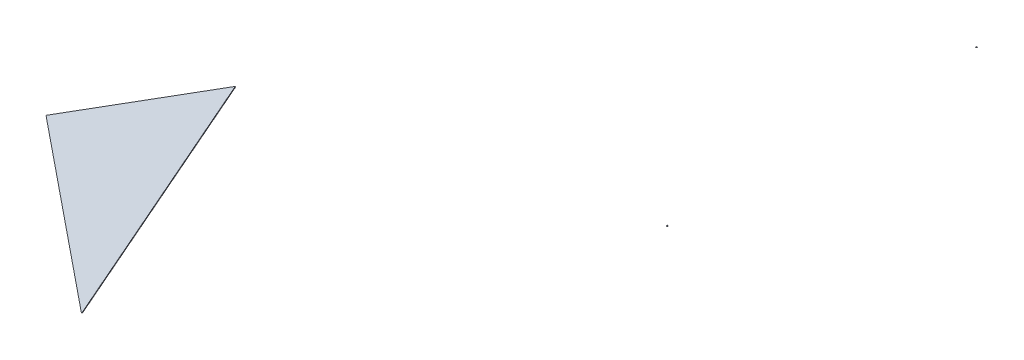
from build123d import *

# Parameters (mm, degrees)
SKETCH2_W          = 846.839584843
SKETCH2_H          = 871.457014635
CUT_EXTRUDE2_DEPTH = 1248.41
SKETCH3_W          = 597.069036036
SKETCH3_H          = 378.549018711
CUT_EXTRUDE3_DEPTH = 327.533


with BuildPart() as part:
    # Boss-Extrude1: read off the stored shape, not the designer's step
    # Boss-Extrude1: loft between two sections, ruled curve by curve
    boss_extrude1_from = [
        Edge.make_line((-86.167457674, 1821.517106037, 1121.25455637), (-492.567457674, 1821.517106037, 1451.45455637)),
        Edge.make_line((-492.567457674, 1821.517106037, 1451.45455637), (752.550801769, 2608.917106037, 1451.45455637)),
        Edge.make_line((752.550801769, 2608.917106037, 1451.45455637), (1158.950801769, 2608.917106037, 1121.25455637)),
        Edge.make_line((1158.950801769, 2608.917106037, 1121.25455637), (-86.167457674, 1821.517106037, 1121.25455637)),
    ]
    boss_extrude1_to = [
        Edge.make_line((-89.342457674, 1821.517106037, 1121.25455637), (-495.742457674, 1821.517106037, 1451.45455637)),
        Edge.make_line((-495.742457674, 1821.517106037, 1451.45455637), (749.375801769, 2608.917106037, 1451.45455637)),
        Edge.make_line((749.375801769, 2608.917106037, 1451.45455637), (1155.775801769, 2608.917106037, 1121.25455637)),
        Edge.make_line((1155.775801769, 2608.917106037, 1121.25455637), (-89.342457674, 1821.517106037, 1121.25455637)),
    ]
    boss_extrude1 = Solid(Shell([*[Face.make_surface_from_curves(boss_extrude1_from[k], boss_extrude1_to[k]) for k in range(4)], Face(Wire(boss_extrude1_from)), Face(Wire(boss_extrude1_to))]))
    add(boss_extrude1)

    # Mirror1: Boss-Extrude1 across plane
    add(boss_extrude1.mirror(Plane.XY.offset(1451.45455637)))

    # Sketch2 → Cut-Extrude2 (cut)
    with BuildSketch(Plane(origin=(1155.775801769, 0, 0), x_dir=(0, 0, -1), z_dir=(1, 0, 0))):
        with Locations((-1412.887955953, 2222.276274549)):
            Rectangle(SKETCH2_W, SKETCH2_H)
    extrude(amount=-CUT_EXTRUDE2_DEPTH, mode=Mode.SUBTRACT)


with BuildPart() as cut_extrude2_piece_1:
    # of the separate pieces the step leaves, piece 1, a body of its own (cut_extrude2_pieces)
    add(part.part.solids().sort_by_distance((-92.634198231, 1821.517106037, 1126.508783072))[0])

    # Sketch3 → Cut-Extrude3 (cut)
    with BuildSketch(Plane.XY.offset(1123.929095572)):
        with Locations((-298.534518018, 1946.185413494)):
            Rectangle(SKETCH3_W, SKETCH3_H)
    extrude(amount=CUT_EXTRUDE3_DEPTH, mode=Mode.SUBTRACT)


with BuildPart() as cut_extrude2_piece_2:
    # of the separate pieces the step leaves, piece 2, a body of its own (cut_extrude2_pieces)
    add(part.part.solids().sort_by_distance((1158.950801769, 2608.917106037, 1121.25455637))[0])


with BuildPart() as cut_extrude2_piece_3:
    # of the separate pieces the step leaves, piece 3, a body of its own (cut_extrude2_pieces)
    add(part.part.solids().sort_by_distance((1155.775801769, 2608.917106037, 1779.074868869))[0])


solid = Compound([cut_extrude2_piece_1.part, cut_extrude2_piece_2.part, cut_extrude2_piece_3.part])
